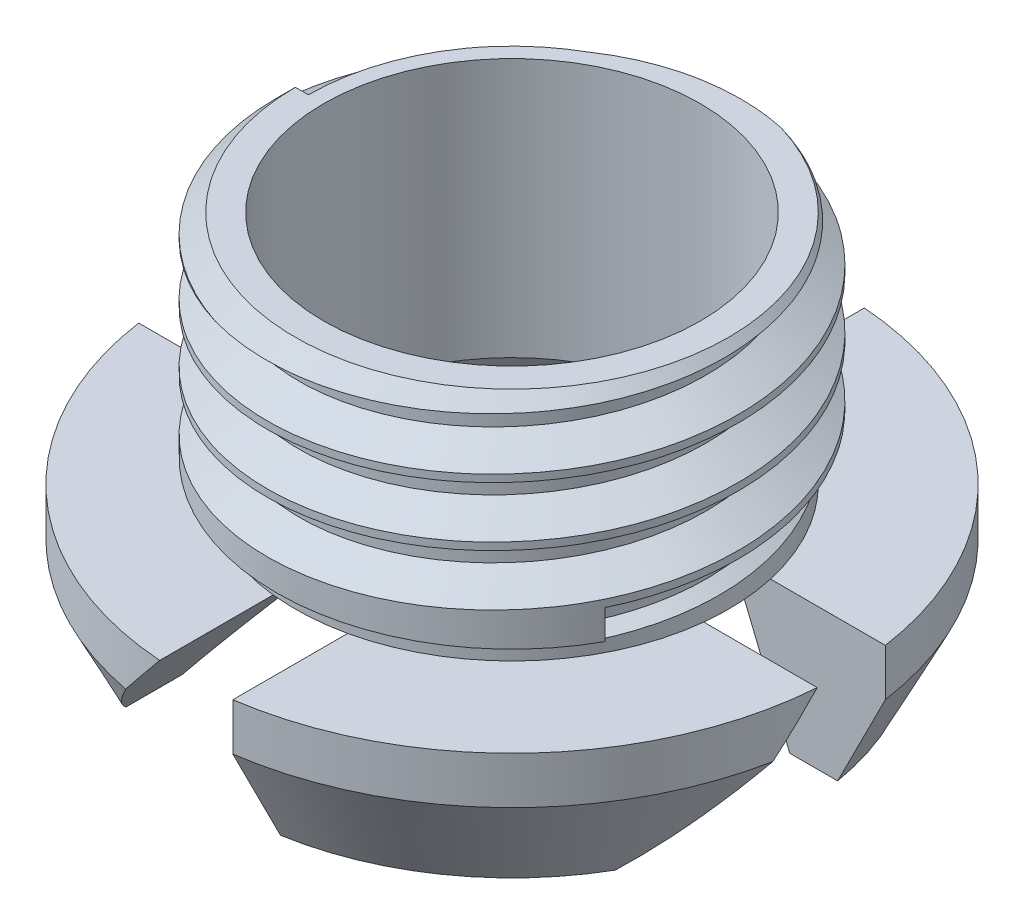
from build123d import *

# Parameters (mm, degrees)
SKETCH_4_W               = 0.8
SKETCH_4_H               = 1
CHAMFER_1_SIZE           = 0.8
CUT_EXTRUDE_1_REACH      = 24.411
PATTERN_CIRCULAR_1_COUNT = 4
THREAD_1_PITCH           = 2.5


with BuildPart() as part:
    # 草图3 → 旋转1 (revolve)
    with BuildSketch(Plane.XY, mode=Mode.PRIVATE) as revolve_1_sk:
        Polygon((8, 5.5), (10, 5.5), (10, -4.5), (14, -4.5), (14, -6.5), (12, -10.5), (10, -10.5), (8, -5.5), align=None)
    revolve(revolve_1_sk.sketch.rotate(Axis((0, 34.557522124, 0), (0, -1, 0)), 90), axis=Axis((0, 34.557522124, 0), (0, -1, 0)))

    # 草图4 → 切除-旋转1 (revolve, cut)
    with BuildSketch(Plane.XY, mode=Mode.PRIVATE) as cut_revolve_1_sk:
        with Locations((9.6, -4)):
            Rectangle(SKETCH_4_W, SKETCH_4_H)
    revolve(cut_revolve_1_sk.sketch.rotate(Axis((0, 6.775681342, 0), (0, -1, 0)), 90), axis=Axis((0, 6.775681342, 0), (0, -1, 0)), mode=Mode.SUBTRACT)

    # 倒角1
    chamfer_1_edges = [part.edges().sort_by_distance(p)[0] for p in [
        (0, 5.5, -10),
    ]]
    chamfer(chamfer_1_edges, length=CHAMFER_1_SIZE)

    # 草图5 → 切除-拉伸1 (cut, up to next)
    with BuildSketch(Plane.XY, mode=Mode.PRIVATE) as cut_extrude_1_sk1:
        Polygon((-1, -4.5), (2, -4.5), (2, -10.5), (-6, -10.5), align=None)
    cut_extrude_1_tool1 = extrude(cut_extrude_1_sk1.sketch, amount=CUT_EXTRUDE_1_REACH, mode=Mode.PRIVATE) & part.part
    cut_extrude_1 = cut_extrude_1_tool1.solids().sort_by_distance((-0.939394, -7.954545, 0))[0]
    add(cut_extrude_1, mode=Mode.SUBTRACT)

    # 阵列(圆周)1: 切除-拉伸1 ×4 about axis
    pattern_circular_1_axis = Axis((0, 0, 0), (0, 1, 0))
    for i in range(1, PATTERN_CIRCULAR_1_COUNT):
        add(cut_extrude_1.rotate(pattern_circular_1_axis, i * 360 / PATTERN_CIRCULAR_1_COUNT), mode=Mode.SUBTRACT)

    # 螺纹线1: arcs per turn and ends read off the stored shape
    # 螺纹线1: the profile of 螺纹线轮廓1 profile screwed along a right-hand helix through 3.58 turns, 10 arcs to a turn; built about Z, then put on its axis
    thread_1_z = Axis((0, 0, 0), (0, 0, 1))
    thread_1_corners = [(10.0003, 0, -0.000173205), (10.0003, 0, 2.187673198), (8.646835313, 0, 1.406249997), (8.646835313, 0, 0.781249997)]
    with BuildLine(mode=Mode.PRIVATE) as thread_1_profile:
        Line(thread_1_corners[0], thread_1_corners[1])
        Line(thread_1_corners[1], thread_1_corners[2])
        Line(thread_1_corners[2], thread_1_corners[3])
        Line(thread_1_corners[3], thread_1_corners[0])
    thread_1_cap = Face(thread_1_profile.wire())
    thread_1_turn_angles = [0, 18, 36, 54, 72, 90, 108, 126, 144, 162, 180, 198, 216, 234, 252, 270, 288, 306, 324, 342, 360]
    thread_1_turn_weights = [1, 0.9510565162951535, 1, 0.9510565162951535, 1, 0.9510565162951535, 1, 0.9510565162951535, 1, 0.9510565162951535, 1, 0.9510565162951535, 1, 0.9510565162951535, 1, 0.9510565162951535, 1, 0.9510565162951535, 1, 0.9510565162951535, 1]
    thread_1_turn_rails = [Edge.make_bspline([Vector(p[0], p[1], 0).rotate(thread_1_z, thread_1_turn_angles[k]) / thread_1_turn_weights[k] + Vector(0, 0, p[2] + THREAD_1_PITCH * thread_1_turn_angles[k] / 360) for k in range(21)], [0, 0, 0, 1, 1, 2, 2, 3, 3, 4, 4, 5, 5, 6, 6, 7, 7, 8, 8, 9, 9, 10, 10, 10], 2, thread_1_turn_weights) for p in thread_1_corners]
    thread_1_turn_sides = [Face.make_surface_from_curves(thread_1_turn_rails[p[0]], thread_1_turn_rails[p[1]]) for p in [(0, 1), (1, 2), (2, 3), (3, 0)]]
    thread_1_last_angles = [1080, 1098, 1116, 1134, 1152, 1170, 1188, 1206, 1224, 1242, 1260, 1274.4, 1288.8]
    thread_1_last_weights = [1, 0.9510565162951535, 1, 0.9510565162951535, 1, 0.9510565162951535, 1, 0.9510565162951535, 1, 0.9510565162951535, 1, 0.9685831611286312, 1]
    thread_1_last_rails = [Edge.make_bspline([Vector(p[0], p[1], 0).rotate(thread_1_z, thread_1_last_angles[k]) / thread_1_last_weights[k] + Vector(0, 0, p[2] + THREAD_1_PITCH * thread_1_last_angles[k] / 360) for k in range(13)], [0, 0, 0, 1, 1, 2, 2, 3, 3, 4, 4, 5, 5, 6, 6, 6], 2, thread_1_last_weights) for p in thread_1_corners]
    thread_1_last_sides = [Face.make_surface_from_curves(thread_1_last_rails[p[0]], thread_1_last_rails[p[1]]) for p in [(0, 1), (1, 2), (2, 3), (3, 0)]]
    thread_1 = Plane(origin=(0, 6.7, 0), x_dir=(-1, 0, 0), z_dir=(0, -1, 0)) * Solid(Shell([*[p.moved(Location((0, 0, THREAD_1_PITCH * i))) for i in range(3) for p in thread_1_turn_sides], *thread_1_last_sides, thread_1_cap, thread_1_cap.rotate(thread_1_z, 1288.8).moved(Location((0, 0, THREAD_1_PITCH * 1288.8 / 360)))]))
    add(thread_1, mode=Mode.SUBTRACT)


solid = part.part
